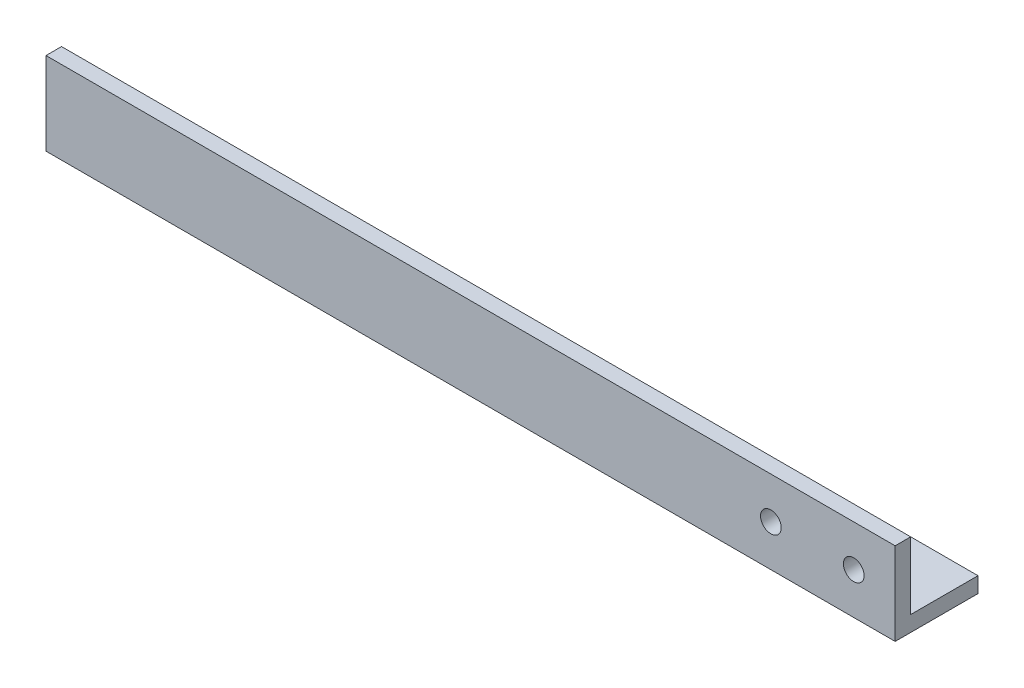
from build123d import *

# Parameters (mm, degrees)
BOSS_EXTRUDE1_DEPTH = 260.35
CUT_EXTRUDE1_REACH  = 264.399
SKETCH2_R           = 3.175
CUT_EXTRUDE2_REACH  = 264.816
SKETCH3_R           = 3.175
CUT_EXTRUDE3_REACH  = 264.816
SKETCH6_R           = 3.175


with BuildPart() as part:
    # Sketch1 → Boss-Extrude1 (new body)
    with BuildSketch(Plane(origin=(0, 0, 0), x_dir=(0, 0, -1), z_dir=(1, 0, 0))):
        Polygon((0, 0), (0, -25.4), (25.4, -25.4), (25.4, -20.6375), (4.7625, -20.6375), (4.7625, 0), align=None)
    extrude(amount=BOSS_EXTRUDE1_DEPTH)

    # Sketch2 → Cut-Extrude1 (cut, up to next)
    with BuildSketch(Plane(origin=(0, -20.6375, 0), x_dir=(1, 0, 0), z_dir=(0, 1, 0)), mode=Mode.PRIVATE) as cut_extrude1_sk1:
        with Locations((9.525, 11.1125)):
            Circle(SKETCH2_R)
    cut_extrude1_tool1 = extrude(cut_extrude1_sk1.sketch, amount=-CUT_EXTRUDE1_REACH, mode=Mode.PRIVATE) & part.part
    # Sketch2 → Cut-Extrude1 (cut, up to next)
    with BuildSketch(Plane(origin=(0, -20.6375, 0), x_dir=(1, 0, 0), z_dir=(0, 1, 0)), mode=Mode.PRIVATE) as cut_extrude1_sk2:
        with Locations((19.05, 17.4625)):
            Circle(SKETCH2_R)
    cut_extrude1_tool2 = extrude(cut_extrude1_sk2.sketch, amount=-CUT_EXTRUDE1_REACH, mode=Mode.PRIVATE) & part.part
    add(cut_extrude1_tool1.solids().sort_by_distance((9.525, -20.6375, -11.1125))[0], mode=Mode.SUBTRACT)
    add(cut_extrude1_tool2.solids().sort_by_distance((19.05, -20.6375, -17.4625))[0], mode=Mode.SUBTRACT)

    # Sketch3 → Cut-Extrude2 (cut, up to next)
    with BuildSketch(Plane.XZ.offset(25.4), mode=Mode.PRIVATE) as cut_extrude2_sk1:
        with Locations((184.095250482, -13.470384182)):
            Circle(SKETCH3_R)
    cut_extrude2_tool1 = extrude(cut_extrude2_sk1.sketch, amount=-CUT_EXTRUDE2_REACH, mode=Mode.PRIVATE) & part.part
    add(cut_extrude2_tool1.solids().sort_by_distance((184.09525, -25.4, -13.470384))[0], mode=Mode.SUBTRACT)

    # Sketch6 → Cut-Extrude3 (cut, up to next)
    with BuildSketch(Plane.XY, mode=Mode.PRIVATE) as cut_extrude3_sk1:
        with Locations((222.25, -12.7)):
            Circle(SKETCH6_R)
    cut_extrude3_tool1 = extrude(cut_extrude3_sk1.sketch, amount=-CUT_EXTRUDE3_REACH, mode=Mode.PRIVATE) & part.part
    # Sketch6 → Cut-Extrude3 (cut, up to next)
    with BuildSketch(Plane.XY, mode=Mode.PRIVATE) as cut_extrude3_sk2:
        with Locations((247.65, -12.7)):
            Circle(SKETCH6_R)
    cut_extrude3_tool2 = extrude(cut_extrude3_sk2.sketch, amount=-CUT_EXTRUDE3_REACH, mode=Mode.PRIVATE) & part.part
    add(cut_extrude3_tool1.solids().sort_by_distance((222.25, -12.7, 0))[0], mode=Mode.SUBTRACT)
    add(cut_extrude3_tool2.solids().sort_by_distance((247.65, -12.7, 0))[0], mode=Mode.SUBTRACT)


solid = part.part
